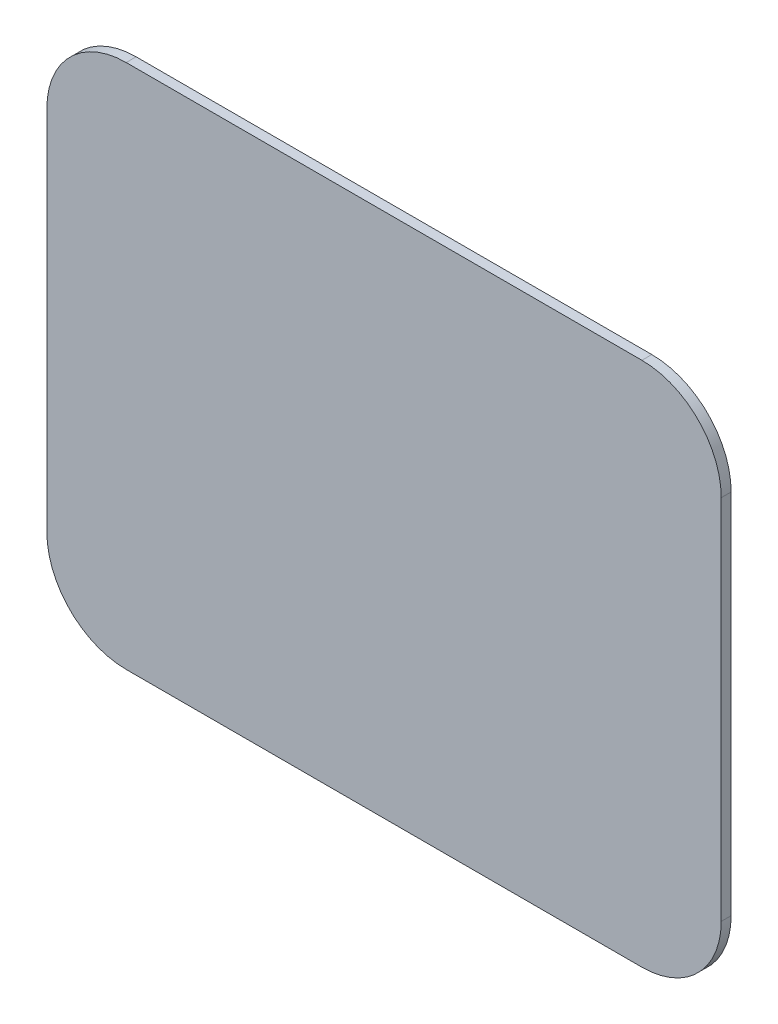
from build123d import *

# Parameters (mm, degrees)
ESQUISSE1_W        = 680
ESQUISSE1_H        = 530
BOSS_EXTRU_1_DEPTH = 10
CONG_1_R           = 80


with BuildPart() as part:
    # Esquisse1 → Boss.-Extru.1 (new body)
    with BuildSketch(Plane.XY):
        Rectangle(ESQUISSE1_W, ESQUISSE1_H)
    extrude(amount=BOSS_EXTRU_1_DEPTH)

    # Congé1
    cong_1_edges = [part.edges().sort_by_distance(p)[0] for p in [
        (-340, 265, 5),
        (340, -265, 5),
        (340, 265, 5),
        (-340, -265, 5),
    ]]
    fillet(cong_1_edges, radius=CONG_1_R)


solid = part.part
